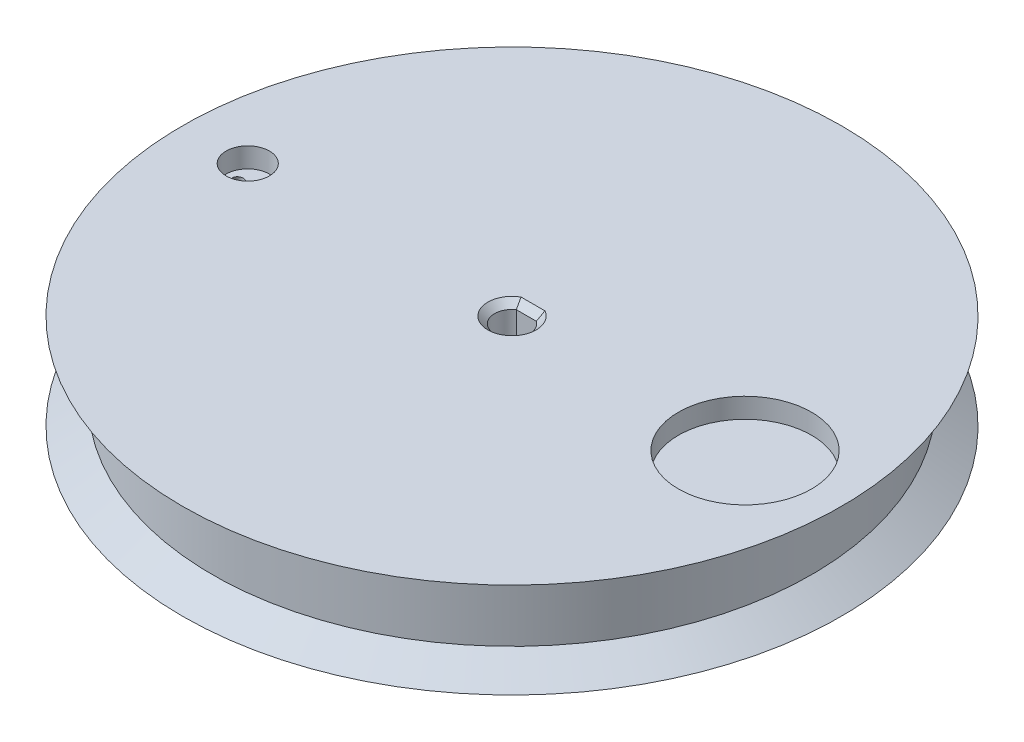
from build123d import *

# Parameters (mm, degrees)
CUT_EXTRUDE2_DEPTH   = 27
CHAMFER2_SIZE        = 1
CUT_SWEEP1_PROFILE_R = 0.75
SKETCH24_R           = 3.248561068
CUT_EXTRUDE7_DEPTH   = 3
SKETCH32_R           = 10
CUT_EXTRUDE9_DEPTH   = 3
SKETCH33_R           = 1.85
CUT_EXTRUDE10_DEPTH  = 26
SKETCH34_R           = 3.65
CUT_EXTRUDE11_DEPTH  = 26
CUT_EXTRUDE13_START  = -14.3
SKETCH26_R           = 34
SKETCH26_R_2         = 11.250223146
CUT_EXTRUDE13_DEPTH  = 3
FILLET1_R            = 1.5


with BuildPart() as part:
    # Sketch2 → Revolve1 (revolve)
    with BuildSketch(Plane.XY, mode=Mode.PRIVATE) as revolve1_sk:
        Polygon((0, 0), (-49.498666221, 0), (-45, 3.15), (-45, 11.15), (-49.498666221, 14.3), (0, 14.3), align=None)
    revolve(revolve1_sk.sketch.rotate(Axis((0, 0, 0), (0, 1, 0)), 270), axis=Axis((0, 0, 0), (0, 1, 0)))

    # Sketch4 → Cut-Extrude2 (cut)
    with BuildSketch(Plane(origin=(0, 14.3, 0), x_dir=(1, 0, 0), z_dir=(0, 1, 0))):
        with BuildLine():
            Line((1.506029548, 2.15), (-1.506029548, 2.15))
            ThreePointArc((-1.506029548, 2.15), (0, -2.625), (1.506029548, 2.15))
        make_face()
    extrude(amount=-CUT_EXTRUDE2_DEPTH, mode=Mode.SUBTRACT)

    # Chamfer2
    chamfer2_edges = [part.edges().sort_by_distance(p)[0] for p in [
        (0, 0, 2.625),
        (0, 0, -2.15),
        (0, 14.3, 2.625),
        (0, 14.3, -2.15),
    ]]
    chamfer(chamfer2_edges, length=CHAMFER2_SIZE)

    # Cut-Sweep1: sweep along a path in Sketch9
    with BuildLine() as cut_sweep1_path:  # in the path sketch's own coordinates; laid on its plane below (add() does not lay a ready-made edge on the line's plane)
        add(Edge.make_bspline(
            [(-51.805130379, 7.70415138), (-45.151420928, 3.291923868), (-39.633758445, 11.086700009), (-39.716744994, 16.706140497)],
            knots=[0, 0, 0, 0, 1, 1, 1, 1], degree=3))
    # Cut-Sweep1 profile (on start of the path) → Cut-Sweep1 (sweep, cut)
    with BuildSketch(Plane(origin=(-51.805130379, 7.70415138, 0), x_dir=(0.5526538855740072, 0.8334108727152246, 0), z_dir=(0.8334108727152246, -0.5526538855740072, 0))):
        Circle(CUT_SWEEP1_PROFILE_R)
    sweep(path=Plane.XY * cut_sweep1_path.line, mode=Mode.SUBTRACT)

    # Sketch24 → Cut-Extrude7 (cut)
    with BuildSketch(Plane(origin=(0, 14.3, 0), x_dir=(1, 0, 0), z_dir=(0, 1, 0))):
        with Locations(Location((-39.688079845, 0, 0), (0, 0, 270))):
            Circle(SKETCH24_R)
    extrude(amount=-CUT_EXTRUDE7_DEPTH, mode=Mode.SUBTRACT)

    # Sketch32 → Cut-Extrude9 (cut)
    with BuildSketch(Plane(origin=(0, 14.3, 0), x_dir=(1, 0, 0), z_dir=(0, 1, 0))):
        with Locations(Location((35, 0, 0), (0, 0, 270))):
            Circle(SKETCH32_R)
    extrude(amount=-CUT_EXTRUDE9_DEPTH, mode=Mode.SUBTRACT)

    # Sketch33 → Cut-Extrude10 (cut)
    with BuildSketch(Plane.XY.offset(-2.15)):
        with Locations((0, 7.15)):
            Circle(SKETCH33_R)
    extrude(amount=-CUT_EXTRUDE10_DEPTH, mode=Mode.SUBTRACT)

    # Sketch34 → Cut-Extrude11 (cut)
    with BuildSketch(Plane.XY.offset(-28.15)):
        with Locations((0, 7.15)):
            Circle(SKETCH34_R)
    extrude(amount=-CUT_EXTRUDE11_DEPTH, mode=Mode.SUBTRACT)

    # Sketch26 → Cut-Extrude13 (cut)
    with BuildSketch(Plane(origin=(0, 14.3, 0), x_dir=(1, 0, 0), z_dir=(0, 1, 0)).offset(CUT_EXTRUDE13_START)):
        with Locations(Location((0, 0, 0), (0, 0, 90))):
            Circle(SKETCH26_R)
        with Locations(Location((0, 0, 0), (0, 0, 90))):
            Circle(SKETCH26_R_2, mode=Mode.SUBTRACT)
    extrude(amount=CUT_EXTRUDE13_DEPTH, mode=Mode.SUBTRACT)

    # Fillet1
    fillet1_edges = [part.edges().sort_by_distance(p)[0] for p in [
        (0, 3, 34),
        (0, 3, 11.250223146),
    ]]
    fillet(fillet1_edges, radius=FILLET1_R)
    fillet1_2_edges = [part.edges().sort_by_distance(p)[0] for p in [
        (0, 0, 34),
        (0, 0, 11.250223146),
    ]]
    fillet(fillet1_2_edges, radius=FILLET1_R - 0.0001)  # a hair under: the kernel refuses the full size


solid = part.part
